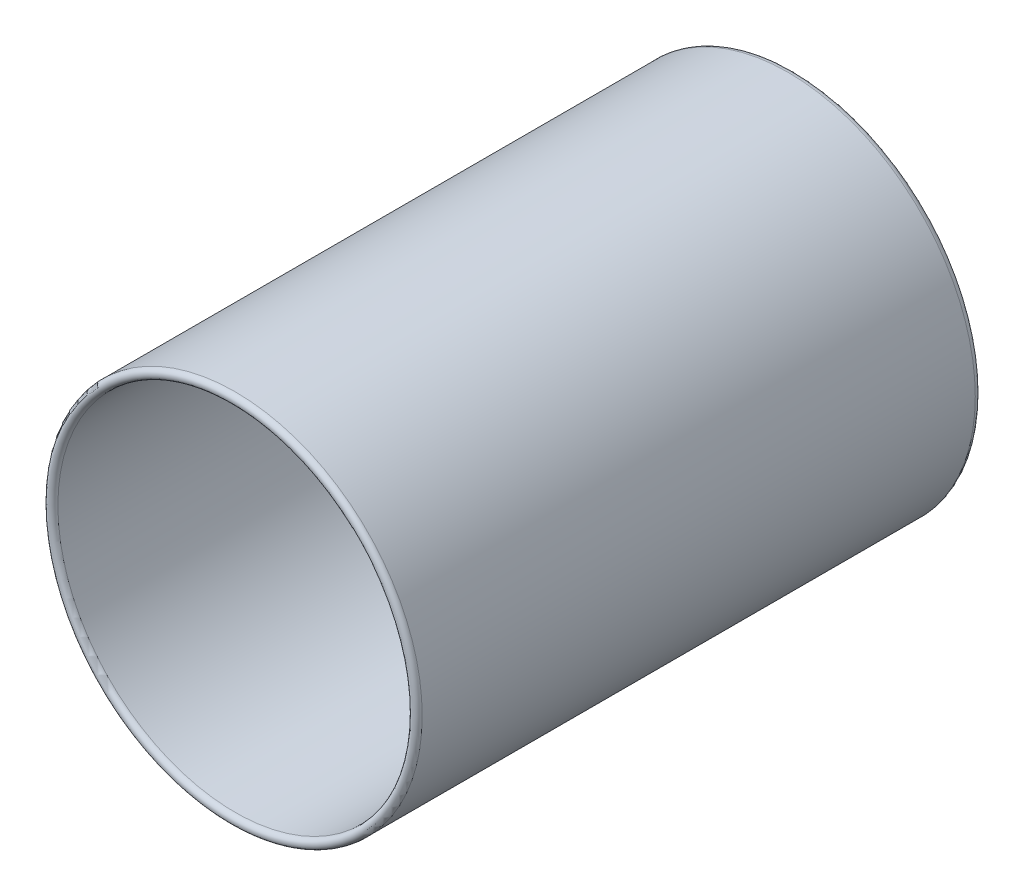
from build123d import *

# Parameters (mm, degrees)
SKETCH1_R           = 28.5
BOSS_EXTRUDE1_DEPTH = 86
SKETCH2_R           = 27
CUT_EXTRUDE1_DEPTH  = 84
FILLET1_R           = 1
FILLET2_R           = 0.75


with BuildPart() as part:
    # Sketch1 → Boss-Extrude1 (new body)
    with BuildSketch(Plane.XY):
        Circle(SKETCH1_R)
    extrude(amount=BOSS_EXTRUDE1_DEPTH)

    # Sketch2 → Cut-Extrude1 (cut)
    with BuildSketch(Plane.XY.offset(86)):
        Circle(SKETCH2_R)
    extrude(amount=-CUT_EXTRUDE1_DEPTH, mode=Mode.SUBTRACT)

    # Fillet1
    fillet1_edges = [part.edges().sort_by_distance(p)[0] for p in [
        (-28.5, 0, 0),
    ]]
    fillet(fillet1_edges, radius=FILLET1_R)

    # Fillet2
    fillet2_edges = [part.edges().sort_by_distance(p)[0] for p in [
        (-28.5, 0, 86),
        (-27, 0, 86),
    ]]
    fillet(fillet2_edges, radius=FILLET2_R - 0.0001)  # a hair under: the kernel refuses the full size


solid = part.part
